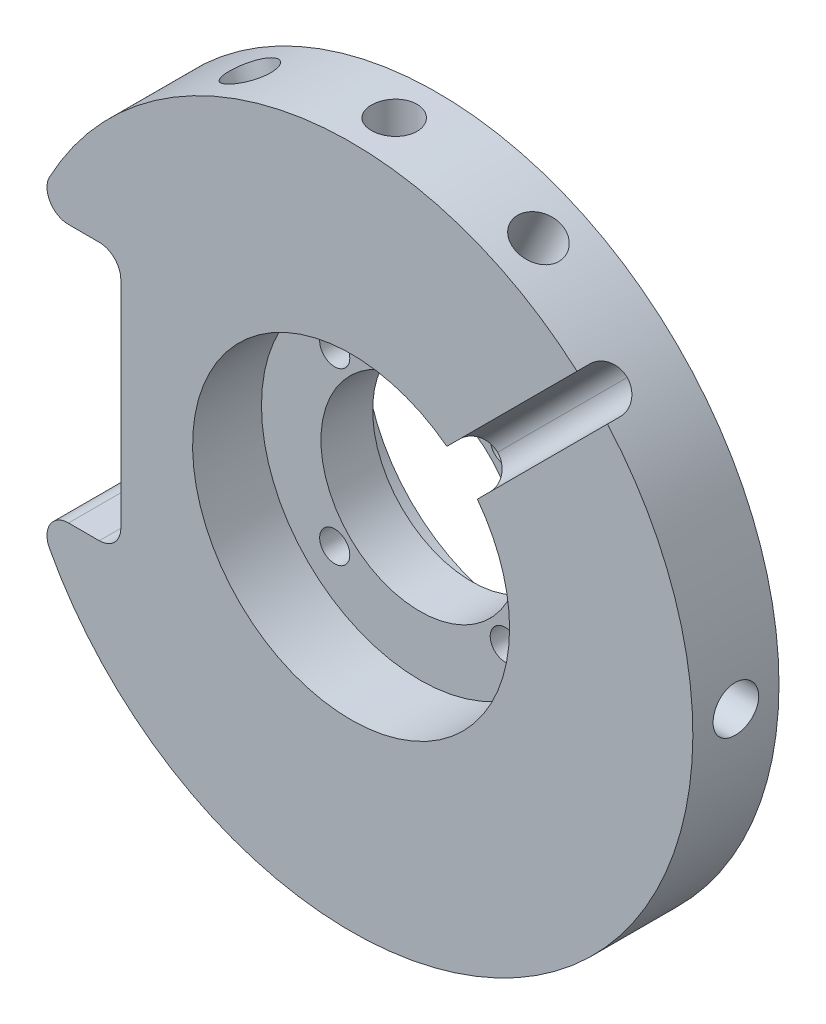
from build123d import *

# Parameters (mm, degrees)
SKETCH_1_R                = 39.675
EXTRUDE_1_DEPTH           = 10
SKETCH_7_R                = 2.65
CUT_EXTRUDE_5_DEPTH       = 8
PATTERN_CIRCULAR_1_COUNT  = 2
PATTERN_CIRCULAR_1_ANGLE  = 25
F_1_THE_OTHER_WAY_COUNT   = 2
F_1_THE_OTHER_WAY_ANGLE   = 25
MIRROR_1_COPY_1_SKETCH_R  = 2.65
MIRROR_1_COPY_1_DEPTH     = 8
MIRROR_1_COPY_2_SKETCH_R  = 2.65
MIRROR_1_COPY_2_DEPTH     = 8
SKETCH_9_R                = 2.65
CUT_EXTRUDE_7_DEPTH       = 8
PATTERN_CIRCULAR_2_COUNT  = 2
CUT_EXTRUDE_START         = -10
CUT_EXTRUDE_8_DEPTH       = 10
CUT_EXTRUDE_13_DEPTH      = 4
SKETCH_12_R               = 25
EXTRUDE_2_DEPTH           = 10
CUT_EXTRUDE_16_DEPTH      = 57.993080877
CUT_EXTRUDE_16_DEPTH_BACK = 57.993080877
SKETCH_18_R               = 11.5
SKETCH_18_R_2             = 1.75
SKETCH_19_R               = 18.4
CUT_EXTRUDE_17_DEPTH      = 6
CUT_EXTRUDE_START_2       = -8
SKETCH_20_R               = 18.4
CUT_EXTRUDE_18_DEPTH      = 8
FILLET_2_R                = 2.5


# Read off the part's stored shape, not the designer's step: Вырез-Вытянуть8
with BuildPart() as part:
    # Эскиз1 → Бобышка-Вытянуть1 (new body)
    with BuildSketch(Plane.XY):
        Circle(SKETCH_1_R)
    extrude(amount=EXTRUDE_1_DEPTH)

    # Эскиз7 → Вырез-Вытянуть5 (cut)
    with BuildSketch(Plane(origin=(0, 39.675, 0), x_dir=(0, 0, -1), z_dir=(0, 1, 0))):
        with Locations(Location((-5, 0, 0), (0, 0, 90))):
            Circle(SKETCH_7_R)
    cut_extrude_5 = extrude(amount=-CUT_EXTRUDE_5_DEPTH, mode=Mode.SUBTRACT)

    # Круговой массив1: Вырез-Вытянуть5 ×2 about axis
    pattern_circular_1_axis = Axis((0, 0, 10), (0, 0, -1))
    for i in range(1, PATTERN_CIRCULAR_1_COUNT):
        add(cut_extrude_5.rotate(pattern_circular_1_axis, i * PATTERN_CIRCULAR_1_ANGLE / (PATTERN_CIRCULAR_1_COUNT - 1)), mode=Mode.SUBTRACT)

    # 1 the other way: Вырез-Вытянуть5 ×2 about axis
    f_1_the_other_way_axis = Axis((0, 0, 10), (0, 0, 1))
    for i in range(1, F_1_THE_OTHER_WAY_COUNT):
        add(cut_extrude_5.rotate(f_1_the_other_way_axis, i * F_1_THE_OTHER_WAY_ANGLE / (F_1_THE_OTHER_WAY_COUNT - 1)), mode=Mode.SUBTRACT)

    # Зеркальное отражение1: Вырез-Вытянуть5 across plane
    add(cut_extrude_5.mirror(Plane.ZX), mode=Mode.SUBTRACT)

    # Зеркальное отражение1 copy 1 sketch → Зеркальное отражение1 copy 1 (cut)
    with BuildSketch(Plane(origin=(16.767379535, -35.957761451, 0), x_dir=(0, 0, -1), z_dir=(0.4226182617407035, -0.906307787036648, 0))):
        with Locations((-5, 0)):
            Circle(MIRROR_1_COPY_1_SKETCH_R)
    extrude(amount=-MIRROR_1_COPY_1_DEPTH, mode=Mode.SUBTRACT)

    # Зеркальное отражение1 copy 2 sketch → Зеркальное отражение1 copy 2 (cut)
    with BuildSketch(Plane(origin=(-16.767379535, -35.957761451, 0), x_dir=(0, 0, -1), z_dir=(-0.42261826174069717, -0.9063077870366509, 0))):
        with Locations((-5, 0)):
            Circle(MIRROR_1_COPY_2_SKETCH_R)
    extrude(amount=-MIRROR_1_COPY_2_DEPTH, mode=Mode.SUBTRACT)

    # Эскиз9 → Вырез-Вытянуть7 (cut)
    with BuildSketch(Plane.ZY.offset(39.675)):
        with Locations((5, 0)):
            Circle(SKETCH_9_R)
    cut_extrude_7 = extrude(amount=-CUT_EXTRUDE_7_DEPTH, mode=Mode.SUBTRACT)

    # Круговой массив2: Вырез-Вытянуть7 ×2 about axis
    pattern_circular_2_axis = Axis((0, 0, 10), (0, 0, -1))
    for i in range(1, PATTERN_CIRCULAR_2_COUNT):
        add(cut_extrude_7.rotate(pattern_circular_2_axis, i * 360 / PATTERN_CIRCULAR_2_COUNT), mode=Mode.SUBTRACT)

    # Вырез-Вытянуть8 outline → Вырез-Вытянуть8 (cut)
    with BuildSketch(Plane(origin=(0, 0, 0), x_dir=(-1, 0, 0), z_dir=(0, 0, -1)).offset(CUT_EXTRUDE_START)):
        with BuildLine():
            Line((36.730173223, 15), (26.730173223, 15))
            Line((26.730173223, 15), (26.730173223, -15))
            Line((26.730173223, -15), (36.730173223, -15))
            ThreePointArc((36.730173223, -15), (39.675, 0), (36.730173223, 15))
        make_face()
    extrude(amount=CUT_EXTRUDE_8_DEPTH, mode=Mode.SUBTRACT)

    # Эскиз15 → Вырез-Вытянуть13 (cut)
    with BuildSketch(Plane.XY.offset(10)):
        Polygon((-1.767766953, 1.767766953), (1.767766953, -1.767766953), (33.587572106, 30.0520382), (30.0520382, 33.587572106), align=None)
    extrude(amount=-CUT_EXTRUDE_13_DEPTH, mode=Mode.SUBTRACT)

    # Эскиз12 → Бобышка-Вытянуть2 (add)
    with BuildSketch(Plane.XY):
        Circle(SKETCH_12_R)
    extrude(amount=-EXTRUDE_2_DEPTH)

    # Эскиз18 → Вырез-Вытянуть16 (cut, two sides: drawn at the far end of the back side and taken through both)
    with BuildSketch(Plane(origin=(0, 0, 0), x_dir=(-1, 0, 0), z_dir=(0, 0, -1)).offset(-CUT_EXTRUDE_16_DEPTH_BACK)):
        Circle(SKETCH_18_R)
        with Locations((9.899494937, 9.899494937)):
            Circle(SKETCH_18_R_2)
        with Locations((9.899494937, -9.899494937)):
            Circle(SKETCH_18_R_2)
        with Locations((-9.899494937, -9.899494937)):
            Circle(SKETCH_18_R_2)
        with Locations((-9.899494937, 9.899494937)):
            Circle(SKETCH_18_R_2)
    extrude(amount=CUT_EXTRUDE_16_DEPTH + CUT_EXTRUDE_16_DEPTH_BACK, mode=Mode.SUBTRACT)

    # Эскиз19 → Вырез-Вытянуть17 (cut)
    with BuildSketch(Plane(origin=(0, 0, -10), x_dir=(-1, 0, 0), z_dir=(0, 0, -1))):
        Circle(SKETCH_19_R)
    extrude(amount=-CUT_EXTRUDE_17_DEPTH, mode=Mode.SUBTRACT)

    # Эскиз20 → Вырез-Вытянуть18 (cut)
    with BuildSketch(Plane.XY.offset(10).offset(CUT_EXTRUDE_START_2)):
        with Locations(Location((0, 0, 0), (0, 0, 180))):
            Circle(SKETCH_20_R)
    extrude(amount=CUT_EXTRUDE_18_DEPTH, mode=Mode.SUBTRACT)

    # Скругление2
    fillet_2_edges = [part.edges().sort_by_distance(p)[0] for p in [
        (18.676644746, 22.212178652, 6),
        (22.212178652, 18.676644746, 6),
        (-26.730173223, 15, 5),
        (-26.730173223, -15, 5),
    ]]
    fillet(fillet_2_edges, radius=FILLET_2_R - 0.0004)  # a hair under: the kernel refuses the full size
    fillet_2_2_edges = [part.edges().sort_by_distance(p)[0] for p in [
        (-36.730173223, -15, 5),
        (-36.730173223, 15, 5),
    ]]
    fillet(fillet_2_2_edges, radius=FILLET_2_R)


solid = part.part
